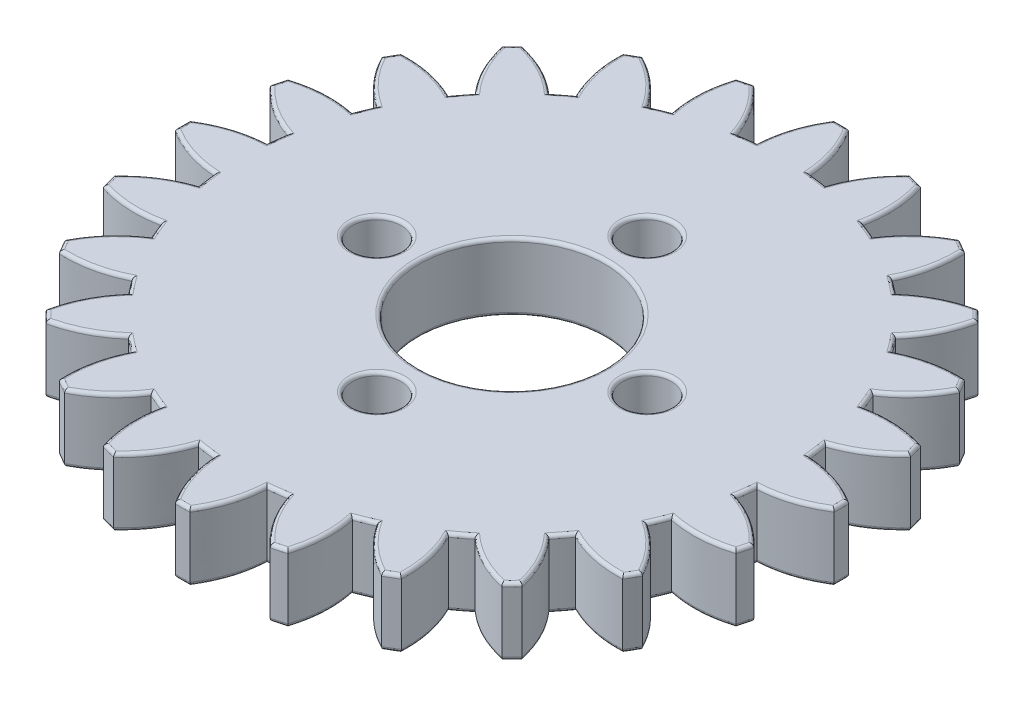
from build123d import *

# Parameters (mm, degrees)
SKETCH_1_R               = 16.125
SKETCH_1_R_2             = 5.5
EXTRUDE_1_DEPTH          = 4
EXTRUDE_2_DEPTH          = 4
PATTERN_CIRCULAR_1_COUNT = 24
SKETCH_2_R               = 1.45
CUT_EXTRUDE_1_DEPTH      = 28.86574974
FILLET_1_R               = 0.2


with BuildPart() as part:
    # 스케치1 → 보스-돌출1 (new body)
    with BuildSketch(Plane(origin=(0, 0, 0), x_dir=(1, 0, 0), z_dir=(0, 1, 0))):
        with Locations(Location((0, 0, 0), (0, 0, 270))):
            Circle(SKETCH_1_R)
        with Locations(Location((0, 0, 0), (0, 0, 270))):
            Circle(SKETCH_1_R_2, mode=Mode.SUBTRACT)
    extrude(amount=EXTRUDE_1_DEPTH)

    # 스케치1<3> → 보스-돌출2 (add)
    with BuildSketch(Plane(origin=(0, 0, 0), x_dir=(1, 0, 0), z_dir=(0, 1, 0))):
        with BuildLine():
            add(Edge.make_bspline(
                [(0.4275, 19.495313379), (1.440935531, 17.924269472), (1.5525, 16.050089369)],
                knots=[0, 0, 0, 1, 1, 1], degree=2))
            ThreePointArc((0.4275, 19.495313379), (0, 19.5), (-0.4275, 19.495313379))
            add(Edge.make_bspline(
                [(-0.4275, 19.495313379), (-1.440935531, 17.924269472), (-1.5525, 16.050089369)],
                knots=[0, 0, 0, 1, 1, 1], degree=2))
            ThreePointArc((-1.5525, 16.050089369), (0, 16.125), (1.5525, 16.050089369))
        make_face()
    extrude_2 = extrude(amount=EXTRUDE_2_DEPTH)

    # 원형 패턴1: 보스-돌출2 ×24 about axis
    pattern_circular_1_axis = Axis((0, 4, 0), (0, -1, 0))
    for i in range(1, PATTERN_CIRCULAR_1_COUNT):
        add(extrude_2.rotate(pattern_circular_1_axis, i * 360 / PATTERN_CIRCULAR_1_COUNT))

    # 스케치2 → 컷-돌출1 (cut, through all)
    with BuildSketch(Plane(origin=(0, 4, 0), x_dir=(1, 0, 0), z_dir=(0, 1, 0))):
        with Locations(Location((0, 8, 0), (0, 0, 270))):
            Circle(SKETCH_2_R)
        with Locations(Location((8, 0, 0), (0, 0, 270))):
            Circle(SKETCH_2_R)
        with Locations(Location((0, -8, 0), (0, 0, 270))):
            Circle(SKETCH_2_R)
        with Locations(Location((-8, 0, 0), (0, 0, 270))):
            Circle(SKETCH_2_R)
    extrude(amount=-CUT_EXTRUDE_1_DEPTH, mode=Mode.SUBTRACT)

    # 필렛1
    fillet_1_edges = [part.edges().sort_by_distance(p)[0] for p in [
        (-12.792822612, 0, 9.816278043),
        (-12.792822612, 4, 9.816278043),
        (1.216094239, 4, -17.846565945),
        (-16.063626598, 4, 7.870114468),
        (-16.887495374, 0, 9.75),
        (-14.847532359, 0, 9.976451477),
        (-16.887495374, 4, 9.75),
        (-14.847532359, 4, 9.976451477),
        (-16.063626598, 0, 7.870114468),
        (0, 0, -19.5),
        (-1.216094239, 0, -17.846565945),
        (-9.816278043, 0, 12.792822612),
        (-9.816278043, 4, 12.792822612),
        (-13.479336284, 4, 11.759519318),
        (-13.788582233, 0, 13.788582233),
        (-11.759519318, 0, 13.479336284),
        (-13.788582233, 4, 13.788582233),
        (-11.759519318, 4, 13.479336284),
        (-13.479336284, 0, 11.759519318),
        (0, 4, -19.5),
        (-1.216094239, 4, -17.846565945),
        (-6.170770347, 0, 14.897557462),
        (-6.170770347, 4, 14.897557462),
        (1.216094239, 0, -17.846565945),
        (-9.976451477, 4, 14.847532359),
        (-9.75, 0, 16.887495374),
        (-7.870114468, 0, 16.063626598),
        (-9.75, 4, 16.887495374),
        (-7.870114468, 4, 16.063626598),
        (-9.976451477, 0, 14.847532359),
        (-2.10473485, 0, 15.98704839),
        (-2.10473485, 4, 15.98704839),
        (-5.793687989, 4, 16.923710607),
        (-5.046971379, 0, 18.835553613),
        (-3.444374323, 0, 17.553207307),
        (-5.046971379, 4, 18.835553613),
        (-3.444374323, 4, 17.553207307),
        (-5.793687989, 0, 16.923710607),
        (2.10473485, 0, 15.98704839),
        (2.10473485, 4, 15.98704839),
        (-1.216094239, 4, 17.846565945),
        (0, 0, 19.5),
        (1.216094239, 0, 17.846565945),
        (0, 4, 19.5),
        (1.216094239, 4, 17.846565945),
        (-1.216094239, 0, 17.846565945),
        (6.170770347, 0, 14.897557462),
        (6.170770347, 4, 14.897557462),
        (3.444374323, 4, 17.553207307),
        (5.046971379, 0, 18.835553613),
        (5.793687989, 0, 16.923710607),
        (5.046971379, 4, 18.835553613),
        (5.793687989, 4, 16.923710607),
        (3.444374323, 0, 17.553207307),
        (9.816278043, 0, 12.792822612),
        (9.816278043, 4, 12.792822612),
        (7.870114468, 4, 16.063626598),
        (9.75, 0, 16.887495374),
        (9.976451477, 0, 14.847532359),
        (9.75, 4, 16.887495374),
        (9.976451477, 4, 14.847532359),
        (7.870114468, 0, 16.063626598),
        (12.792822612, 0, 9.816278043),
        (12.792822612, 4, 9.816278043),
        (11.759519318, 4, 13.479336284),
        (13.788582233, 0, 13.788582233),
        (13.479336284, 0, 11.759519318),
        (13.788582233, 4, 13.788582233),
        (13.479336284, 4, 11.759519318),
        (11.759519318, 0, 13.479336284),
        (14.897557462, 0, 6.170770347),
        (14.897557462, 4, 6.170770347),
        (14.847532359, 4, 9.976451477),
        (16.887495374, 0, 9.75),
        (16.063626598, 0, 7.870114468),
        (16.887495374, 4, 9.75),
        (16.063626598, 4, 7.870114468),
        (14.847532359, 0, 9.976451477),
        (15.98704839, 0, 2.10473485),
        (15.98704839, 4, 2.10473485),
        (16.923710607, 4, 5.793687989),
        (18.835553613, 0, 5.046971379),
        (17.553207307, 0, 3.444374323),
        (18.835553613, 4, 5.046971379),
        (17.553207307, 4, 3.444374323),
        (16.923710607, 0, 5.793687989),
        (15.98704839, 0, -2.10473485),
        (15.98704839, 4, -2.10473485),
        (17.846565945, 4, 1.216094239),
        (19.5, 0, 0),
        (17.846565945, 0, -1.216094239),
        (19.5, 4, 0),
        (17.846565945, 4, -1.216094239),
        (17.846565945, 0, 1.216094239),
        (-6.170770347, 0, -14.897557462),
        (-6.170770347, 4, -14.897557462),
        (14.897557462, 0, -6.170770347),
        (14.897557462, 4, -6.170770347),
        (17.553207307, 4, -3.444374323),
        (18.835553613, 0, -5.046971379),
        (16.923710607, 0, -5.793687989),
        (18.835553613, 4, -5.046971379),
        (16.923710607, 4, -5.793687989),
        (17.553207307, 0, -3.444374323),
        (12.792822612, 0, -9.816278043),
        (12.792822612, 4, -9.816278043),
        (-3.444374323, 4, -17.553207307),
        (16.063626598, 4, -7.870114468),
        (16.887495374, 0, -9.75),
        (14.847532359, 0, -9.976451477),
        (16.887495374, 4, -9.75),
        (14.847532359, 4, -9.976451477),
        (16.063626598, 0, -7.870114468),
        (-5.046971379, 0, -18.835553613),
        (-5.793687989, 0, -16.923710607),
        (9.816278043, 0, -12.792822612),
        (9.816278043, 4, -12.792822612),
        (13.479336284, 4, -11.759519318),
        (13.788582233, 0, -13.788582233),
        (11.759519318, 0, -13.479336284),
        (13.788582233, 4, -13.788582233),
        (11.759519318, 4, -13.479336284),
        (13.479336284, 0, -11.759519318),
        (-5.046971379, 4, -18.835553613),
        (-5.793687989, 4, -16.923710607),
        (6.170770347, 0, -14.897557462),
        (-3.444374323, 0, -17.553207307),
        (6.170770347, 4, -14.897557462),
        (9.976451477, 4, -14.847532359),
        (9.75, 0, -16.887495374),
        (7.870114468, 0, -16.063626598),
        (9.75, 4, -16.887495374),
        (7.870114468, 4, -16.063626598),
        (9.976451477, 0, -14.847532359),
        (2.10473485, 0, -15.98704839),
        (2.10473485, 4, -15.98704839),
        (5.793687989, 4, -16.923710607),
        (5.046971379, 0, -18.835553613),
        (3.444374323, 0, -17.553207307),
        (5.046971379, 4, -18.835553613),
        (3.444374323, 4, -17.553207307),
        (5.793687989, 0, -16.923710607),
        (0, 0, -9.45),
        (0, 4, -9.45),
        (8, 0, -1.45),
        (8, 4, -1.45),
        (0, 0, 6.55),
        (0, 4, 6.55),
        (-8, 0, -1.45),
        (-8, 4, -1.45),
        (-9.816278043, 0, -12.792822612),
        (-9.816278043, 4, -12.792822612),
        (-7.870114468, 4, -16.063626598),
        (-9.75, 0, -16.887495374),
        (-9.976451477, 0, -14.847532359),
        (-9.75, 4, -16.887495374),
        (-9.976451477, 4, -14.847532359),
        (-7.870114468, 0, -16.063626598),
        (0, 0, -5.5),
        (-12.792822612, 0, -9.816278043),
        (-12.792822612, 4, -9.816278043),
        (-11.759519318, 4, -13.479336284),
        (-13.788582233, 0, -13.788582233),
        (-13.479336284, 0, -11.759519318),
        (-13.788582233, 4, -13.788582233),
        (-13.479336284, 4, -11.759519318),
        (-11.759519318, 0, -13.479336284),
        (-14.897557462, 0, -6.170770347),
        (-14.897557462, 4, -6.170770347),
        (-14.847532359, 4, -9.976451477),
        (-16.887495374, 0, -9.75),
        (-16.063626598, 0, -7.870114468),
        (-16.887495374, 4, -9.75),
        (-16.063626598, 4, -7.870114468),
        (-14.847532359, 0, -9.976451477),
        (-15.98704839, 0, -2.10473485),
        (-15.98704839, 4, -2.10473485),
        (-16.923710607, 4, -5.793687989),
        (0, 4, -5.5),
        (-18.835553613, 0, -5.046971379),
        (-17.553207307, 0, -3.444374323),
        (-18.835553613, 4, -5.046971379),
        (-17.553207307, 4, -3.444374323),
        (-16.923710607, 0, -5.793687989),
        (-15.98704839, 0, 2.10473485),
        (-15.98704839, 4, 2.10473485),
        (-17.846565945, 4, -1.216094239),
        (-19.5, 0, 0),
        (-17.846565945, 0, 1.216094239),
        (-19.5, 4, 0),
        (-17.846565945, 4, 1.216094239),
        (-17.846565945, 0, -1.216094239),
        (-2.10473485, 0, -15.98704839),
        (-14.897557462, 0, 6.170770347),
        (-14.897557462, 4, 6.170770347),
        (-17.553207307, 4, 3.444374323),
        (-18.835553613, 0, 5.046971379),
        (-16.923710607, 0, 5.793687989),
        (-2.10473485, 4, -15.98704839),
        (-18.835553613, 4, 5.046971379),
        (-16.923710607, 4, 5.793687989),
        (-17.553207307, 0, 3.444374323),
    ]]
    fillet(fillet_1_edges, radius=FILLET_1_R)


solid = part.part
